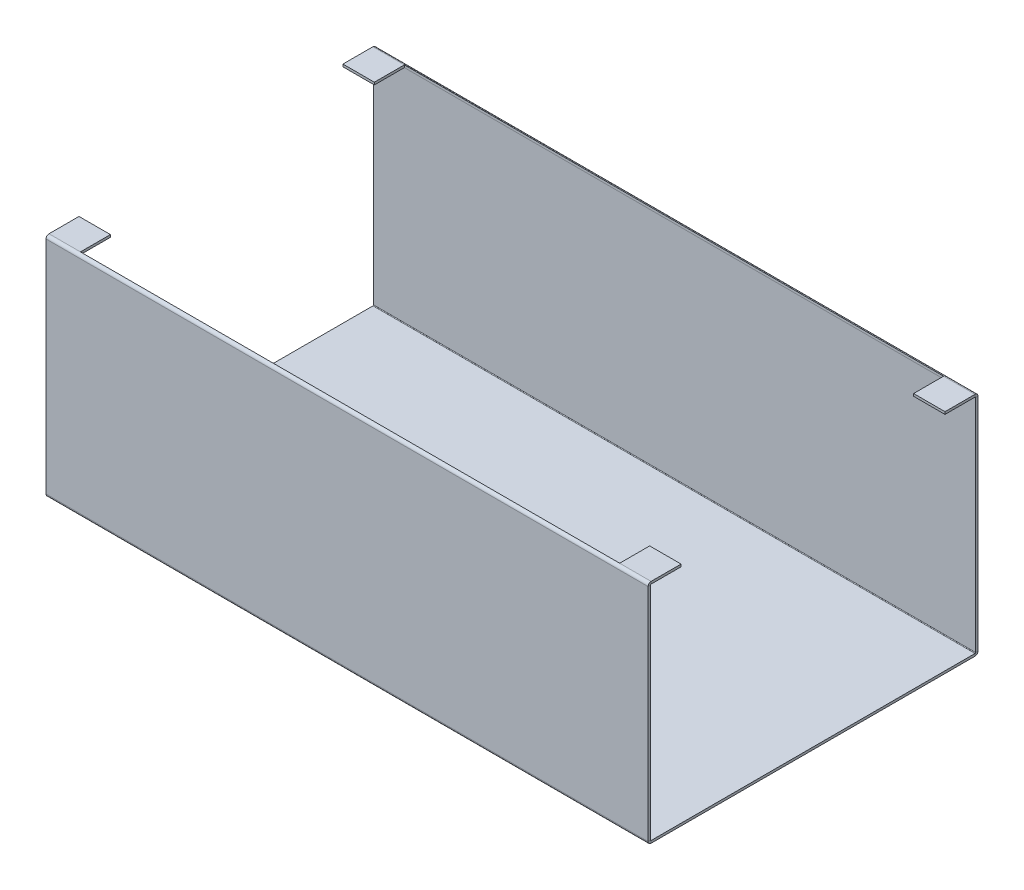
from build123d import *

# Parameters (mm, degrees)
CROQUIS1_W                         = 730
CROQUIS1_H                         = 400
BRIDA_BASE1_DEPTH                  = 2.9
BRIDA_DE_ARISTA1_STRIP_W           = 13.0732
BRIDA_DE_ARISTA1_STRIP_H           = 2.9
BRIDA_DE_ARISTA1_STRIP_CUT_DEPTH   = 730
BRIDA_DE_ARISTA1_STRIP_2_W         = 13.0732
BRIDA_DE_ARISTA1_STRIP_2_H         = 2.9
BRIDA_DE_ARISTA1_STRIP_CUT_2_DEPTH = 730
BRIDA_DE_ARISTA1_DEPTH             = 730
BRIDA_DE_ARISTA1_BEND_DEPTH        = 730
BRIDA_DE_ARISTA2_STRIP_W           = 13.0732
BRIDA_DE_ARISTA2_STRIP_H           = 2.9
BRIDA_DE_ARISTA2_STRIP_CUT_DEPTH   = 730
BRIDA_DE_ARISTA2_STRIP_2_W         = 13.0732
BRIDA_DE_ARISTA2_STRIP_2_H         = 2.9
BRIDA_DE_ARISTA2_STRIP_CUT_2_DEPTH = 730
BRIDA_DE_ARISTA2_DEPTH             = 730
BRIDA_DE_ARISTA2_BEND_DEPTH        = 730
CROQUIS18_W                        = 653.8
CROQUIS18_H                        = 36.3634
CORTAR_EXTRUIR1_DEPTH              = 4


# Sheet-metal steps are written as plain solids
with BuildPart() as part:
    # Croquis1 → Brida base1 (new body)
    with BuildSketch(Plane(origin=(0, 0, 0), x_dir=(1, 0, 0), z_dir=(0, 1, 0))):
        Rectangle(CROQUIS1_W, CROQUIS1_H)
    extrude(amount=-BRIDA_BASE1_DEPTH)

    # Brida de arista1 strip (across the edge) → Brida de arista1 strip cut (cut)
    with BuildSketch(Plane(origin=(365, 0, -200), x_dir=(0, 0, 1), z_dir=(-1, 0, 0))):
        with Locations((-2.9, -1.45)):
            Rectangle(BRIDA_DE_ARISTA1_STRIP_W, BRIDA_DE_ARISTA1_STRIP_H)
    extrude(amount=BRIDA_DE_ARISTA1_STRIP_CUT_DEPTH, mode=Mode.SUBTRACT)

    # Brida de arista1 strip 2 (across the edge) → Brida de arista1 strip cut 2 (cut)
    with BuildSketch(Plane(origin=(-365, 0, 200), x_dir=(0, 0, -1), z_dir=(1, 0, 0))):
        with Locations((-2.9, -1.45)):
            Rectangle(BRIDA_DE_ARISTA1_STRIP_2_W, BRIDA_DE_ARISTA1_STRIP_2_H)
    extrude(amount=BRIDA_DE_ARISTA1_STRIP_CUT_2_DEPTH, mode=Mode.SUBTRACT)

    # Brida de arista1 section (across the edge) → Brida de arista1 (add)
    with BuildSketch(Plane(origin=(365, 0, -200), x_dir=(0, 0, 1), z_dir=(-1, 0, 0))):
        with BuildLine():
            Line((0, 0.7366), (0, 272.1))
            Line((0, 272.1), (2.9, 272.1))
            Line((2.9, 272.1), (2.9, 0.7366))
            ThreePointArc((2.9, 0.7366), (3.115745145, 0.215745145), (3.6366, 0))
            Line((3.6366, 0), (3.6366, -2.9))
            ThreePointArc((3.6366, -2.9), (1.06513548, -1.83486452), (0, 0.7366))
        make_face()
    extrude(amount=BRIDA_DE_ARISTA1_DEPTH)

    # Brida de arista1 section 2 (across the edge) → Brida de arista1 bend (add)
    with BuildSketch(Plane(origin=(-365, 0, 200), x_dir=(0, 0, -1), z_dir=(1, 0, 0))):
        with BuildLine():
            Line((0, 0.7366), (0, 272.1))
            Line((0, 272.1), (2.9, 272.1))
            Line((2.9, 272.1), (2.9, 0.7366))
            ThreePointArc((2.9, 0.7366), (3.115745145, 0.215745145), (3.6366, 0))
            Line((3.6366, 0), (3.6366, -2.9))
            ThreePointArc((3.6366, -2.9), (1.06513548, -1.83486452), (0, 0.7366))
        make_face()
    extrude(amount=BRIDA_DE_ARISTA1_BEND_DEPTH)

    # Brida de arista2 strip (across the edge) → Brida de arista2 strip cut (cut)
    with BuildSketch(Plane(origin=(365, 272.1, -197.1), x_dir=(0, -1, 0), z_dir=(-1, 0, 0))):
        with Locations((-2.9, -1.45)):
            Rectangle(BRIDA_DE_ARISTA2_STRIP_W, BRIDA_DE_ARISTA2_STRIP_H)
    extrude(amount=BRIDA_DE_ARISTA2_STRIP_CUT_DEPTH, mode=Mode.SUBTRACT)

    # Brida de arista2 strip 2 (across the edge) → Brida de arista2 strip cut 2 (cut)
    with BuildSketch(Plane(origin=(-365, 272.1, 197.1), x_dir=(0, -1, 0), z_dir=(1, 0, 0))):
        with Locations((-2.9, -1.45)):
            Rectangle(BRIDA_DE_ARISTA2_STRIP_2_W, BRIDA_DE_ARISTA2_STRIP_2_H)
    extrude(amount=BRIDA_DE_ARISTA2_STRIP_CUT_2_DEPTH, mode=Mode.SUBTRACT)

    # Brida de arista2 section (across the edge) → Brida de arista2 (add)
    with BuildSketch(Plane(origin=(365, 272.1, -197.1), x_dir=(0, -1, 0), z_dir=(-1, 0, 0))):
        with BuildLine():
            Line((0, 0.7366), (0, 37.1))
            Line((0, 37.1), (2.9, 37.1))
            Line((2.9, 37.1), (2.9, 0.7366))
            ThreePointArc((2.9, 0.7366), (3.115745145, 0.215745145), (3.6366, 0))
            Line((3.6366, 0), (3.6366, -2.9))
            ThreePointArc((3.6366, -2.9), (1.06513548, -1.83486452), (0, 0.7366))
        make_face()
    extrude(amount=BRIDA_DE_ARISTA2_DEPTH)

    # Brida de arista2 section 2 (across the edge) → Brida de arista2 bend (add)
    with BuildSketch(Plane(origin=(-365, 272.1, 197.1), x_dir=(0, -1, 0), z_dir=(1, 0, 0))):
        with BuildLine():
            Line((0, 0.7366), (0, 37.1))
            Line((0, 37.1), (2.9, 37.1))
            Line((2.9, 37.1), (2.9, 0.7366))
            ThreePointArc((2.9, 0.7366), (3.115745145, 0.215745145), (3.6366, 0))
            Line((3.6366, 0), (3.6366, -2.9))
            ThreePointArc((3.6366, -2.9), (1.06513548, -1.83486452), (0, 0.7366))
        make_face()
    extrude(amount=BRIDA_DE_ARISTA2_BEND_DEPTH)

    # Croquis18 → Cortar-Extruir1 (cut)
    with BuildSketch(Plane(origin=(0, 272.1, 0), x_dir=(1, 0, 0), z_dir=(0, 1, 0))):
        with Locations((0, -178.1817)):
            Rectangle(CROQUIS18_W, CROQUIS18_H)
        with Locations((0, 178.1817)):
            Rectangle(CROQUIS18_W, CROQUIS18_H)
    extrude(amount=-CORTAR_EXTRUIR1_DEPTH, mode=Mode.SUBTRACT)


solid = part.part
